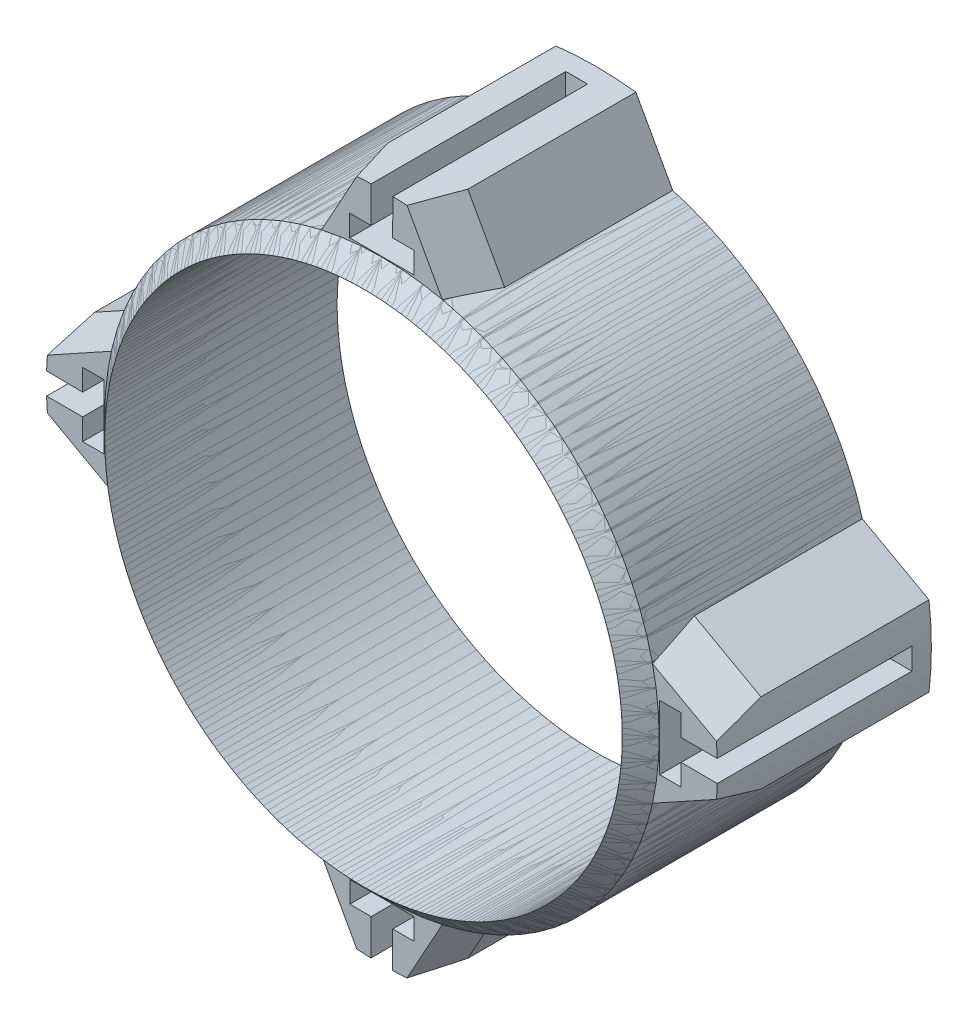
from build123d import *

# Parameters (mm, degrees)
SKETCH1_R           = 90.5
SKETCH1_R_2         = 84.5
BOSS_EXTRUDE1_DEPTH = 76.35
CHAMFER1_SIZE       = 6.5
WRAP12_SECTION_W    = 19
WRAP12_SECTION_H    = 69.85
WRAP12_ANGLE        = 32.161608832
CUT_EXTRUDE1_DEPTH  = 63.5
CHAMFER2_SIZE       = 19
CHAMFER5_SIZE       = 15
CHAMFER5_SIZE_2     = 4.019237886
CIRPATTERN6_COUNT   = 4


with BuildPart() as part:
    # Sketch1 → Boss-Extrude1 (new body)
    with BuildSketch(Plane.XY):
        Circle(SKETCH1_R)
        Circle(SKETCH1_R_2, mode=Mode.SUBTRACT)
    extrude(amount=BOSS_EXTRUDE1_DEPTH)

    # Chamfer1
    # the kernel refuses this chamfer: 6.5 mm, written as the material it takes off along each edge
    with BuildSketch(Plane(origin=(0, 0, 76.35), x_dir=(1, 0, 0), z_dir=(0, -1, 0))) as chamfer1_piece_1:
        Polygon((90.5, -CHAMFER1_SIZE), (90.5 - CHAMFER1_SIZE, 0), (90.5, 0), align=None)
    revolve(axis=Axis((0, 0, 76.35), (0, 0, 1)), mode=Mode.SUBTRACT)

    # Wrap12 section (on wrap section) → Wrap12 (revolve)
    with BuildSketch(Plane(origin=(0, 0, 0), x_dir=(0.9608717281441653, 0.276993722046629, 0), z_dir=(-0.276993722046629, 0.9608717281441653, 0))):
        with Locations((100, -34.925)):
            Rectangle(WRAP12_SECTION_W, WRAP12_SECTION_H)
    revolve(axis=Axis((0, 0, 0), (0, 0, -1)), revolution_arc=WRAP12_ANGLE)

    # Sketch12 → Cut-Extrude1 (cut)
    with BuildSketch(Plane.XY.offset(69.85)):
        Polygon((122.706651928, -0.201195148), (122.706651928, 3.507927311), (97.67138598, 3.507927311), (97.67138598, 10.503148948), (90.66864355, 10.503148948), (90.66864355, -10.492123054), (97.67138598, -10.492123054), (97.67138598, -3.492123054), (122.706651928, -3.70406248), align=None)
    extrude(amount=-CUT_EXTRUDE1_DEPTH, mode=Mode.SUBTRACT)

    # Chamfer2
    # the kernel refuses this chamfer: 19 mm, written as the material it takes off along each edge
    with BuildSketch(Plane(origin=(105.215515497, -30.330600038, 118.711976771), x_dir=(-0.9608722876451651, 0.27699178116967144, 0), z_dir=(0, 0, -1))) as chamfer2_piece_1_section:
        with BuildLine():
            Line((CHAMFER2_SIZE, 0), (1.420369251, 17.579630749))
            ThreePointArc((1.420369251, 17.579630749), (0.375784571, 9.063973019), (0, 0))
            Line((0, 0), (CHAMFER2_SIZE, 0))
        make_face()
    chamfer2_piece_1 = extrude(amount=167.573953543, mode=Mode.PRIVATE)
    chamfer2_piece_1 = chamfer2_piece_1 - Plane(origin=(0, 0, 118.711976771), x_dir=(1, 0, 0), z_dir=(0, 0, -1)) * Cylinder(90.5, 412, mode=Mode.PRIVATE)
    add(chamfer2_piece_1, mode=Mode.SUBTRACT)
    with BuildSketch(Plane(origin=(105.215454232, 30.330812564, 118.711976771), x_dir=(-0.9608717281441654, -0.2769937220466291, 0), z_dir=(0, 0, -1))) as chamfer2_piece_2_section:
        with BuildLine():
            Line((CHAMFER2_SIZE, 0), (1.420369251, -17.579630749))
            ThreePointArc((1.420369251, -17.579630749), (0.375784571, -9.063973019), (0, 0))
            Line((0, 0), (CHAMFER2_SIZE, 0))
        make_face()
    chamfer2_piece_2 = extrude(amount=167.573953543, mode=Mode.PRIVATE)
    chamfer2_piece_2 = chamfer2_piece_2 - Plane(origin=(0, 0, 118.711976771), x_dir=(1, 0, 0), z_dir=(0, 0, -1)) * Cylinder(90.5, 412, mode=Mode.PRIVATE)
    add(chamfer2_piece_2, mode=Mode.SUBTRACT)

    # Chamfer5
    # the kernel refuses this chamfer: 15, 4.019237886 mm, written as the material it takes off along each edge
    with BuildSketch(Plane(origin=(52.865116584, 43.903567605, 69.85), x_dir=(0, 0, -1), z_dir=(0.8753030540266438, -0.483574775615551, 0))) as chamfer5_piece_1_section:
        Polygon((CHAMFER5_SIZE, 0), (0, -CHAMFER5_SIZE_2), (0, 0), align=None)
    chamfer5_piece_1 = extrude(amount=102.762999332, mode=Mode.PRIVATE)
    chamfer5_piece_1 = chamfer5_piece_1 - Plane(origin=(0, 0, 69.85), x_dir=(1, 0, 0), z_dir=(0, 0, -1)) * Cylinder(90.5, 266, mode=Mode.PRIVATE)
    add(chamfer5_piece_1, mode=Mode.SUBTRACT)
    with BuildSketch(Plane(origin=(52.865205265, -43.903460822, 69.85), x_dir=(0, 0, -1), z_dir=(0.8753020772463168, 0.48357654364979585, 0))) as chamfer5_piece_2_section:
        Polygon((CHAMFER5_SIZE, 0), (0, CHAMFER5_SIZE_2), (0, 0), align=None)
    chamfer5_piece_2 = extrude(amount=102.762999332, mode=Mode.PRIVATE)
    chamfer5_piece_2 = chamfer5_piece_2 - Plane(origin=(0, 0, 69.85), x_dir=(1, 0, 0), z_dir=(0, 0, -1)) * Cylinder(90.5, 266, mode=Mode.PRIVATE)
    add(chamfer5_piece_2, mode=Mode.SUBTRACT)


with BuildPart() as cirpattern6_1:
    # CirPattern6: pattern copy
    add(part.part.rotate(Axis((0, 0, 0), (0, 0, 1)), 1 * 360 / CIRPATTERN6_COUNT))


with BuildPart() as cirpattern6_2:
    # CirPattern6: pattern copy
    add(part.part.rotate(Axis((0, 0, 0), (0, 0, 1)), 2 * 360 / CIRPATTERN6_COUNT))


with BuildPart() as cirpattern6_3:
    # CirPattern6: pattern copy
    add(part.part.rotate(Axis((0, 0, 0), (0, 0, 1)), 3 * 360 / CIRPATTERN6_COUNT))


solid = Compound([part.part, cirpattern6_1.part, cirpattern6_2.part, cirpattern6_3.part])
